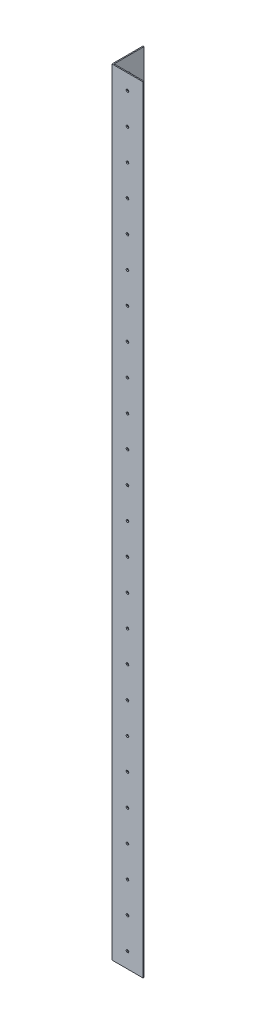
from build123d import *

# Parameters (mm, degrees)
EXTRUDE_1_DEPTH     = 1500
SKETCH_2_R          = 2.5
CUT_EXTRUDE_1_DEPTH = 1503.398083066
SKETCH_3_R          = 2.5
CUT_EXTRUDE_2_DEPTH = 1503.398083066


with BuildPart() as part:
    # Эскиз1 → Вытянуть-Тонкостенный1 (new body)
    with BuildSketch(Plane(origin=(0, 0, 0), x_dir=(1, 0, 0), z_dir=(0, 1, 0))):
        Polygon((0, 60), (0, 0), (60, 0), (60, 2), (2, 2), (2, 60), align=None)
    extrude(amount=EXTRUDE_1_DEPTH)

    # Эскиз2 → Вырез-Вытянуть1 (cut, through all)
    with BuildSketch(Plane.ZY):
        with Locations((-30, 30)):
            Circle(SKETCH_2_R)
        with Locations((-30, 90)):
            Circle(SKETCH_2_R)
        with Locations((-30, 150)):
            Circle(SKETCH_2_R)
        with Locations((-30, 210)):
            Circle(SKETCH_2_R)
        with Locations((-30, 270)):
            Circle(SKETCH_2_R)
        with Locations((-30, 330)):
            Circle(SKETCH_2_R)
        with Locations((-30, 390)):
            Circle(SKETCH_2_R)
        with Locations((-30, 450)):
            Circle(SKETCH_2_R)
        with Locations((-30, 510)):
            Circle(SKETCH_2_R)
        with Locations((-30, 570)):
            Circle(SKETCH_2_R)
        with Locations((-30, 630)):
            Circle(SKETCH_2_R)
        with Locations((-30, 690)):
            Circle(SKETCH_2_R)
        with Locations((-30, 750)):
            Circle(SKETCH_2_R)
        with Locations((-30, 810)):
            Circle(SKETCH_2_R)
        with Locations((-30, 870)):
            Circle(SKETCH_2_R)
        with Locations((-30, 930)):
            Circle(SKETCH_2_R)
        with Locations((-30, 990)):
            Circle(SKETCH_2_R)
        with Locations((-30, 1050)):
            Circle(SKETCH_2_R)
        with Locations((-30, 1110)):
            Circle(SKETCH_2_R)
        with Locations((-30, 1170)):
            Circle(SKETCH_2_R)
        with Locations((-30, 1230)):
            Circle(SKETCH_2_R)
        with Locations((-30, 1290)):
            Circle(SKETCH_2_R)
        with Locations((-30, 1350)):
            Circle(SKETCH_2_R)
        with Locations((-30, 1410)):
            Circle(SKETCH_2_R)
        with Locations((-30, 1470)):
            Circle(SKETCH_2_R)
    extrude(amount=-CUT_EXTRUDE_1_DEPTH, mode=Mode.SUBTRACT)

    # Эскиз3 → Вырез-Вытянуть2 (cut, through all)
    with BuildSketch(Plane.XY):
        with Locations((30, 30)):
            Circle(SKETCH_3_R)
        with Locations((30, 90)):
            Circle(SKETCH_3_R)
        with Locations((30, 150)):
            Circle(SKETCH_3_R)
        with Locations((30, 210)):
            Circle(SKETCH_3_R)
        with Locations((30, 270)):
            Circle(SKETCH_3_R)
        with Locations((30, 330)):
            Circle(SKETCH_3_R)
        with Locations((30, 390)):
            Circle(SKETCH_3_R)
        with Locations((30, 450)):
            Circle(SKETCH_3_R)
        with Locations((30, 510)):
            Circle(SKETCH_3_R)
        with Locations((30, 570)):
            Circle(SKETCH_3_R)
        with Locations((30, 630)):
            Circle(SKETCH_3_R)
        with Locations((30, 690)):
            Circle(SKETCH_3_R)
        with Locations((30, 750)):
            Circle(SKETCH_3_R)
        with Locations((30, 810)):
            Circle(SKETCH_3_R)
        with Locations((30, 870)):
            Circle(SKETCH_3_R)
        with Locations((30, 930)):
            Circle(SKETCH_3_R)
        with Locations((30, 990)):
            Circle(SKETCH_3_R)
        with Locations((30, 1050)):
            Circle(SKETCH_3_R)
        with Locations((30, 1110)):
            Circle(SKETCH_3_R)
        with Locations((30, 1170)):
            Circle(SKETCH_3_R)
        with Locations((30, 1230)):
            Circle(SKETCH_3_R)
        with Locations((30, 1290)):
            Circle(SKETCH_3_R)
        with Locations((30, 1350)):
            Circle(SKETCH_3_R)
        with Locations((30, 1410)):
            Circle(SKETCH_3_R)
        with Locations((30, 1470)):
            Circle(SKETCH_3_R)
    extrude(amount=-CUT_EXTRUDE_2_DEPTH, mode=Mode.SUBTRACT)


solid = part.part
